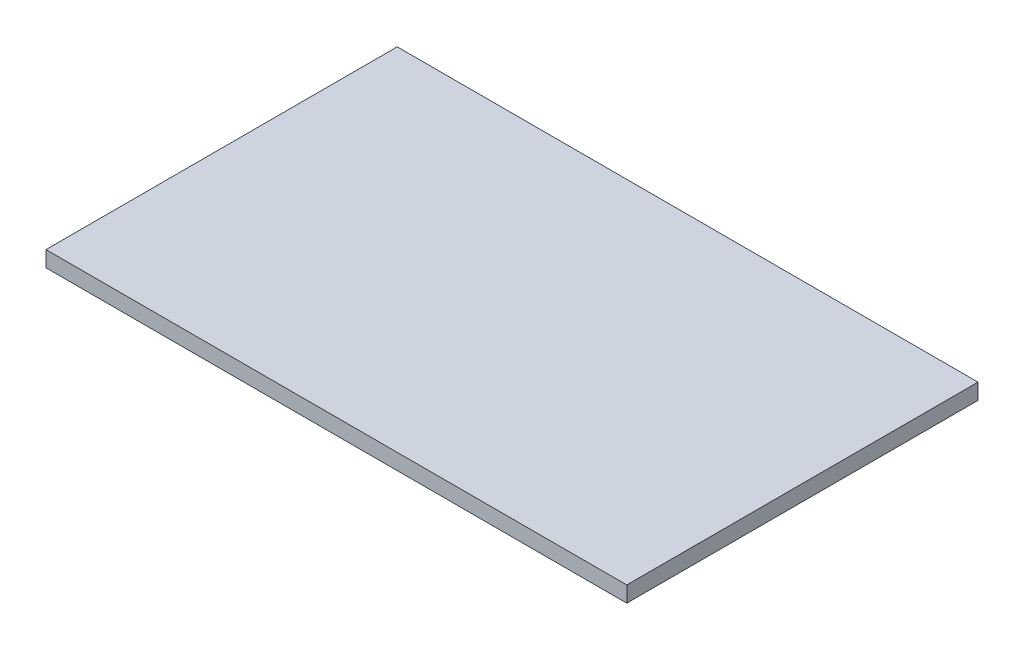
from build123d import *

# Parameters (mm, degrees)
SKETCH1_W           = 93.29039011
SKETCH1_H           = 56.413822292
BOSS_EXTRUDE1_DEPTH = 2.54


with BuildPart() as part:
    # Sketch1 → Boss-Extrude1 (new body)
    with BuildSketch(Plane(origin=(0, 0, 0), x_dir=(1, 0, 0), z_dir=(0, 1, 0))):
        Rectangle(SKETCH1_W, SKETCH1_H)
    extrude(amount=BOSS_EXTRUDE1_DEPTH)


solid = part.part
